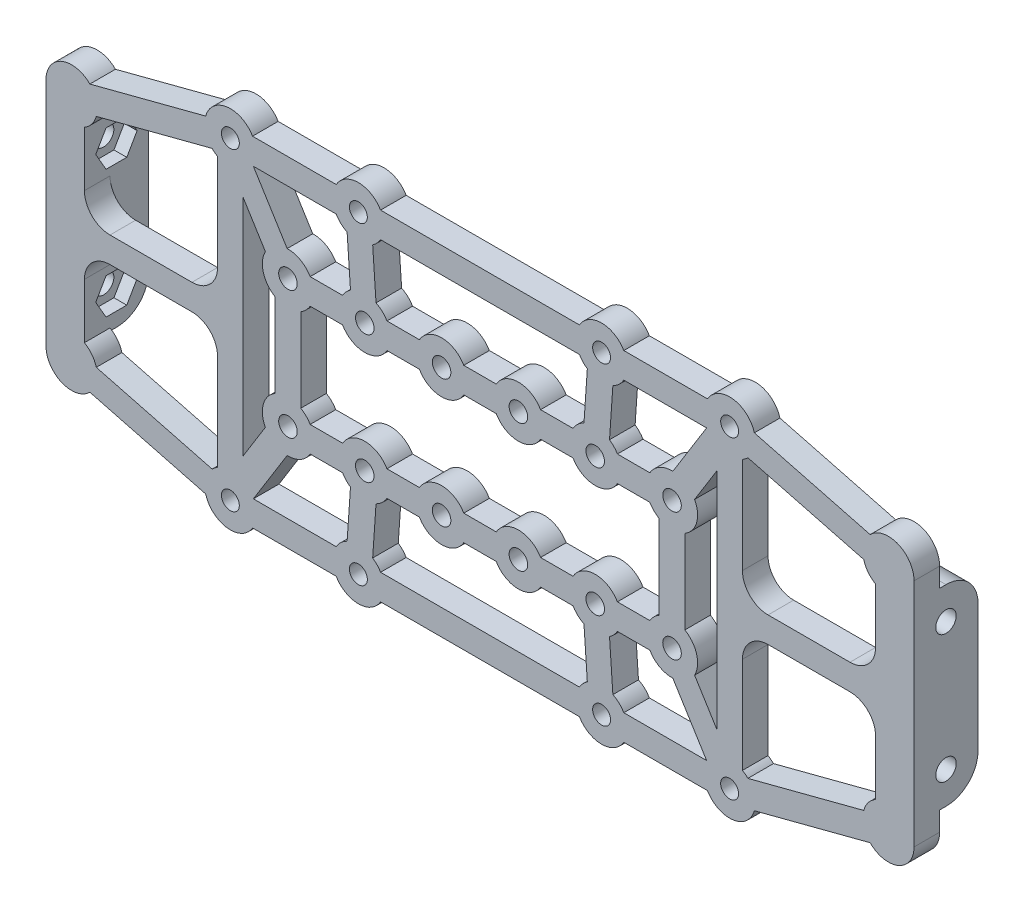
from build123d import *

# Parameters (mm, degrees)
BOSS_EXTRU_1_DEPTH      = 4
ESQUISSE2_R             = 1.4
ESQUISSE2_R_2           = 1.45
ENL_V_MAT_EXTRU_1_DEPTH = 74.65538098
ESQUISSE3_W             = 6
ESQUISSE3_H             = 15
BOSS_EXTRU_2_DEPTH      = 6
ESQUISSE4_R             = 1.6
ENL_V_MAT_EXTRU_2_DEPTH = 9
CONG_1_R                = 5
CONG_5_R                = 4
ENL_V_MAT_EXTRU_3_DEPTH = 2
CONG_1_OF_SYM_TRIE3_R   = 5
CONG_5_OF_SYM_TRIE3_R   = 4


# Read off the part's stored shape, not the designer's step: Symétrie4
with BuildPart() as part:
    # Esquisse1 → Boss.-Extru.1 (new body)
    with BuildSketch(Plane.XY):
        with BuildLine():
            Line((-35.535898385, 26.5), (-22.464101615, 26.5))
            ThreePointArc((-22.464101615, 26.5), (-19, 28.5), (-15.535898385, 26.5))
            Line((-15.535898385, 26.5), (0, 26.5))
            Line((0, 26.5), (0, 22.5))
            Line((0, 22.5), (-15.535898385, 22.5))
            ThreePointArc((-15.535898385, 22.5), (-16.075890438, 21.770607528), (-16.766401906, 21.181711351))
            Line((-16.766401906, 21.181711351), (-16.24307678, 13.593497015))
            ThreePointArc((-16.24307678, 13.593497015), (-15.270607528, 12.924109562), (-14.535898385, 12))
            Line((-14.535898385, 12), (-9.464101615, 12))
            ThreePointArc((-9.464101615, 12), (-6, 14), (-2.535898385, 12))
            Line((-2.535898385, 12), (0, 12))
            Line((0, 12), (0, 8))
            Line((0, 8), (-2.535898385, 8))
            ThreePointArc((-2.535898385, 8), (-6, 6), (-9.464101615, 8))
            Line((-9.464101615, 8), (-14.535898385, 8))
            ThreePointArc((-14.535898385, 8), (-18, 6), (-21.464101615, 8))
            Line((-21.464101615, 8), (-26.535898385, 8))
            ThreePointArc((-26.535898385, 8), (-27.171572875, 7.171572875), (-28, 6.535898385))
            Line((-28, 6.535898385), (-28, 0))
            Line((-28, 0), (-32, 0))
            Line((-32, 0), (-32, 6.535898385))
            ThreePointArc((-32, 6.535898385), (-33.846702657, 8.903241745), (-33.526118874, 11.888514148))
            Line((-33.526118874, 11.888514148), (-37, 17.48532263))
            Line((-37, 17.48532263), (-37, 0))
            Line((-37, 0), (-41, 0))
            Line((-41, 0), (-61.5, 0))
            Line((-61.5, 0), (-67.8, 0))
            Line((-67.8, 0), (-67.8, 18))
            ThreePointArc((-67.8, 18), (-65.335916847, 21.731961323), (-60.952242292, 20.847292746))
            Line((-60.952242292, 20.847292746), (-42.856442509, 25.562003379))
            ThreePointArc((-42.856442509, 25.562003379), (-39.508372166, 28.467563199), (-35.535898385, 26.5))
        make_face()
        with BuildLine():
            Line((-41, 21.035898385), (-41, 2))
            Line((-41, 2), (-61.8, 2))
            Line((-61.8, 2), (-61.8, 14.574522717))
            ThreePointArc((-61.8, 14.574522717), (-60.635155729, 15.592584539), (-59.943742943, 16.976513876))
            Line((-59.943742943, 16.976513876), (-41.84794316, 21.691224509))
            ThreePointArc((-41.84794316, 21.691224509), (-41.446017437, 21.335035751), (-41, 21.035898385))
        make_face(mode=Mode.SUBTRACT)
        with BuildLine():
            Line((-35.404683012, 22.5), (-22.464101615, 22.5))
            ThreePointArc((-22.464101615, 22.5), (-21.729392472, 21.575890438), (-20.75692322, 20.906502985))
            Line((-20.75692322, 20.906502985), (-20.233598094, 13.318288649))
            ThreePointArc((-20.233598094, 13.318288649), (-20.924109562, 12.729392472), (-21.464101615, 12))
            Line((-21.464101615, 12), (-26.535898385, 12))
            ThreePointArc((-26.535898385, 12), (-28.055495666, 13.495554733), (-30.127558209, 13.997965596))
            Line((-30.127558209, 13.997965596), (-35.404683012, 22.5))
        make_face(mode=Mode.SUBTRACT)
    boss_extru_1 = extrude(amount=BOSS_EXTRU_1_DEPTH)

    # Esquisse2 → Enlèv. mat.-Extru.1 (cut, through all)
    with BuildSketch(Plane.XY.offset(4)):
        with Locations((-39, 24.5)):
            Circle(ESQUISSE2_R)
        with Locations((-19, 24.5)):
            Circle(ESQUISSE2_R)
        with Locations((-30, 10)):
            Circle(ESQUISSE2_R_2)
        with Locations((-18, 10)):
            Circle(ESQUISSE2_R_2)
        with Locations((-6, 10)):
            Circle(ESQUISSE2_R_2)
    enl_v_mat_extru_1 = extrude(amount=-ENL_V_MAT_EXTRU_1_DEPTH, mode=Mode.SUBTRACT)

    # Esquisse3 → Boss.-Extru.2 (add)
    with BuildSketch(Plane(origin=(0, 0, 0), x_dir=(-1, 0, 0), z_dir=(0, 0, -1))):
        with Locations((64.8, 7.5)):
            Rectangle(ESQUISSE3_W, ESQUISSE3_H)
    boss_extru_2 = extrude(amount=BOSS_EXTRU_2_DEPTH)

    # Esquisse4 → Enlèv. mat.-Extru.2 (cut)
    with BuildSketch(Plane(origin=(-61.8, 0, 0), x_dir=(0, 0, -1), z_dir=(1, 0, 0))):
        with Locations((1, 10)):
            Circle(ESQUISSE4_R)
    enl_v_mat_extru_2 = extrude(amount=-ENL_V_MAT_EXTRU_2_DEPTH, mode=Mode.SUBTRACT)

    # Congé1
    cong_1_edges = [part.edges().sort_by_distance(p)[0] for p in [
        (-64.8, 15, -6),
    ]]
    fillet(cong_1_edges, radius=CONG_1_R)

    # Congé5
    cong_5_edges = [part.edges().sort_by_distance(p)[0] for p in [
        (-61.8, 2, 2),
        (-41, 2, 2),
    ]]
    fillet(cong_5_edges, radius=CONG_5_R)

    # Esquisse5 → Enlèv. mat.-Extru.3 (cut)
    with BuildSketch(Plane(origin=(-61.8, 0, 0), x_dir=(0, 0, -1), z_dir=(1, 0, 0))):
        Polygon((2.616580754, 12.8), (-0.616580754, 12.8), (-2.233161507, 10), (-0.616580754, 7.2), (2.616580754, 7.2), (4.233161507, 10), align=None)
    enl_v_mat_extru_3 = extrude(amount=-ENL_V_MAT_EXTRU_3_DEPTH, mode=Mode.SUBTRACT)

    # Symétrie3: Boss.-Extru.1, Enlèv. mat.-Extru.1, Boss.-Extru.2, Enlèv. mat.-Extru.2, Enlèv. mat.-Extru.3 across plane
    add(boss_extru_1.mirror(Plane.ZX))
    add(enl_v_mat_extru_1.mirror(Plane.ZX), mode=Mode.SUBTRACT)
    add(boss_extru_2.mirror(Plane.ZX))
    add(enl_v_mat_extru_2.mirror(Plane.ZX), mode=Mode.SUBTRACT)
    add(enl_v_mat_extru_3.mirror(Plane.ZX), mode=Mode.SUBTRACT)

    # Congé1 of Symétrie3
    cong_1_of_sym_trie3_edges = [part.edges().sort_by_distance(p)[0] for p in [
        (-64.8, -15, -6),
    ]]
    fillet(cong_1_of_sym_trie3_edges, radius=CONG_1_OF_SYM_TRIE3_R)

    # Congé5 of Symétrie3
    cong_5_of_sym_trie3_edges = [part.edges().sort_by_distance(p)[0] for p in [
        (-61.8, -2, 2),
        (-41, -2, 2),
    ]]
    fillet(cong_5_of_sym_trie3_edges, radius=CONG_5_OF_SYM_TRIE3_R)

    # Symétrie4: part across plane


with BuildPart() as part_1:
    add(part.part)
    add(part.part.mirror(Plane(origin=(0, 0, 0), x_dir=(0, 0, 1), z_dir=(1, 0, 0))))


solid = part_1.part
